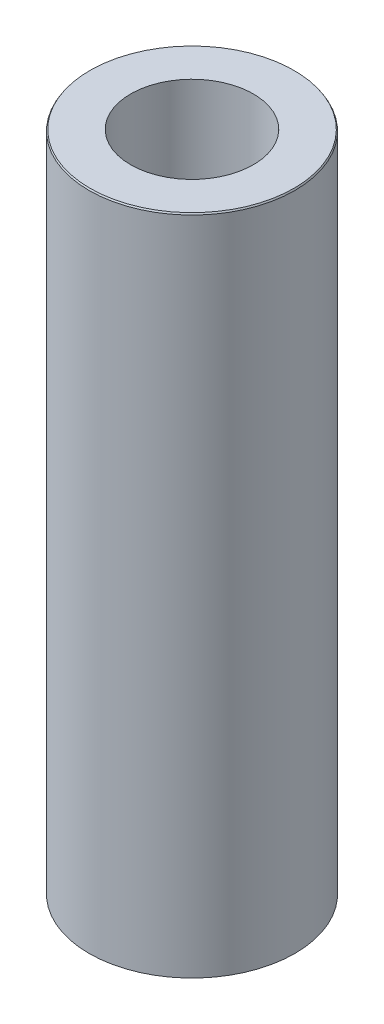
from build123d import *
from OCP.BRepFilletAPI import BRepFilletAPI_MakeChamfer

# Parameters (mm, degrees)
SKETCH1_R           = 47.5
BOSS_EXTRUDE1_DEPTH = 306.037137291
SKETCH2_R           = 28.327991277
CUT_EXTRUDE1_DEPTH  = 314.322883622
CHAMFER1_SIZE       = 0.684863028
CHAMFER1_SIZE2      = 0.395405854


with BuildPart() as part:
    # Sketch1 → Boss-Extrude1 (new body)
    with BuildSketch(Plane(origin=(0, 0, 0), x_dir=(1, 0, 0), z_dir=(0, 1, 0))):
        Circle(SKETCH1_R)
    extrude(amount=BOSS_EXTRUDE1_DEPTH)

    # Sketch2 → Cut-Extrude1 (cut, through all)
    with BuildSketch(Plane(origin=(0, 0, 0), x_dir=(1, 0, 0), z_dir=(0, 1, 0))):
        Circle(SKETCH2_R)
    extrude(amount=CUT_EXTRUDE1_DEPTH, mode=Mode.SUBTRACT)

    # Chamfer1: one chamfer whose edges measure the first distance from different faces: ONE call of the kernel's chamfer builder (chamfer() names one face for all edges)
    chamfer1_edges_1 = [part.edges().sort_by_distance(p)[0] for p in [
        (-47.5, 306.037137291, 0),
    ]]
    chamfer1_side_1 = [part.faces().sort_by_distance(p)[0] for p in [
        (-47.5, 153.018568646, 0),
    ]]
    chamfer1_edges_2 = [part.edges().sort_by_distance(p)[0] for p in [
        (-47.5, 0, 0),
    ]]
    chamfer1_side_2 = [part.faces().sort_by_distance(p)[0] for p in [
        (-46.156497116, 0, 0),
    ]]
    chamfer1 = BRepFilletAPI_MakeChamfer(part.part.solid().wrapped)
    for e in chamfer1_edges_1:
        chamfer1.Add(CHAMFER1_SIZE, CHAMFER1_SIZE2, e.wrapped, chamfer1_side_1[0].wrapped)  # the first distance lies on this face
    for e in chamfer1_edges_2:
        chamfer1.Add(CHAMFER1_SIZE, CHAMFER1_SIZE2, e.wrapped, chamfer1_side_2[0].wrapped)  # the first distance lies on this face
    add(Compound.cast(chamfer1.Shape()), mode=Mode.REPLACE)


solid = part.part
